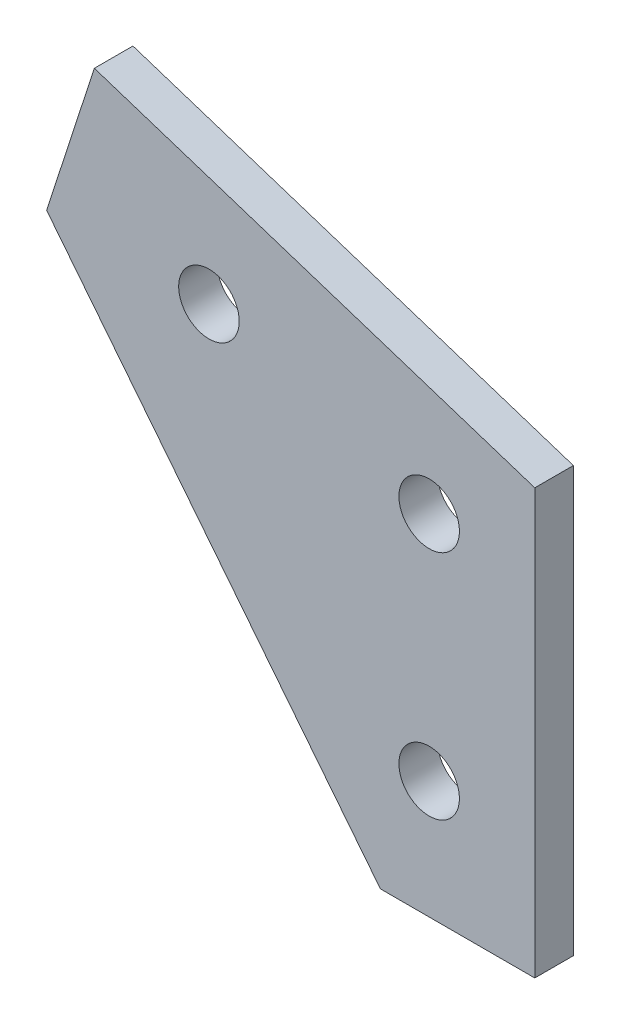
from build123d import *

# Parameters (mm, degrees)
BOSS_EXTRUDE1_DEPTH    = 3.175
F_10_CLEARANCE_HOLE1_D = 4.9784


with BuildPart() as part:
    # Sketch4 → Boss-Extrude1 (new body)
    with BuildSketch(Plane.XY):
        Polygon((-42.954209552, 292.801454104), (-6.718956281, 281.027906618), (-6.718956281, 246.102906618), (-19.418956281, 246.102906618), (-46.878725381, 280.723036347), align=None)
    extrude(amount=BOSS_EXTRUDE1_DEPTH)

    # #10 Clearance Hole1 (through all)
    with Locations(Plane.XY.offset(3.175)):
        with Locations((-33.525155133, 280.723036347), (-15.407528498, 274.836262604), (-15.407528498, 255.786262604)):
            Hole(F_10_CLEARANCE_HOLE1_D / 2)


solid = part.part
